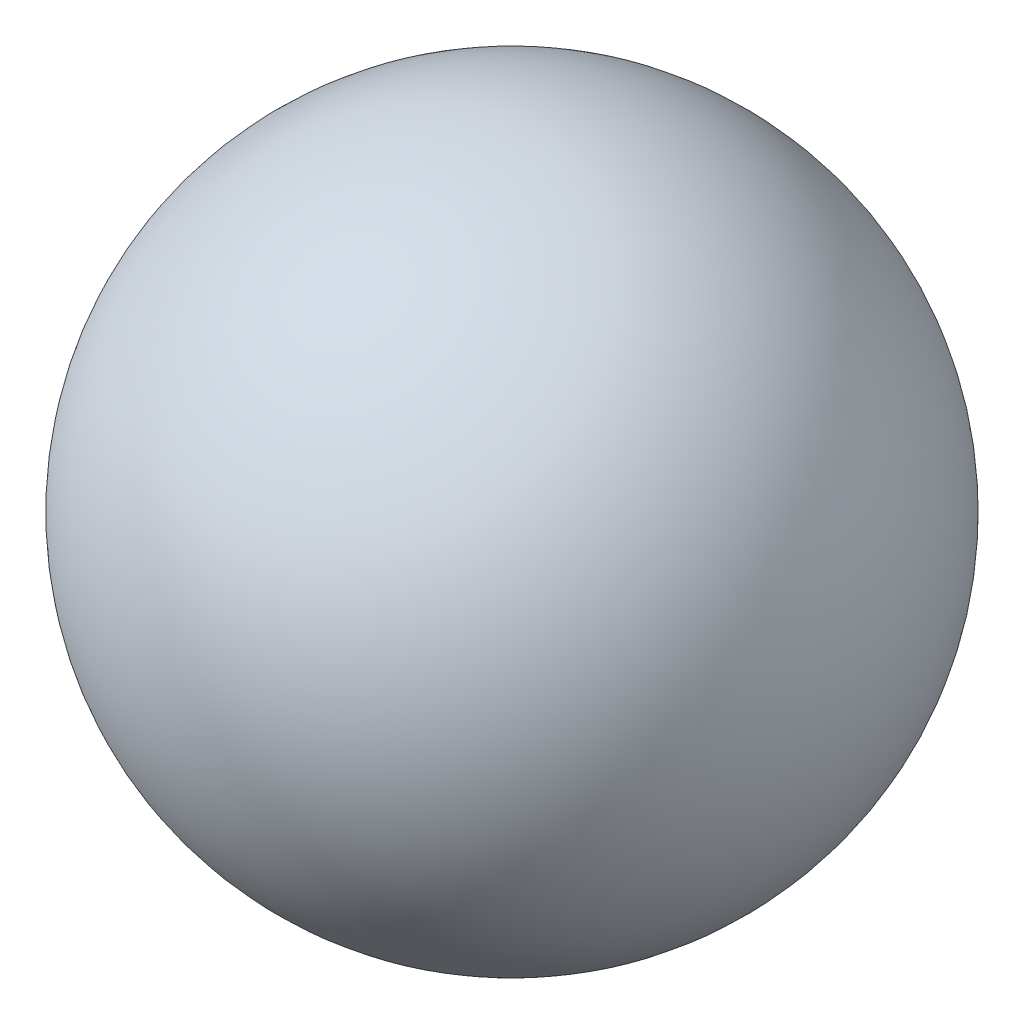
from build123d import *


with BuildPart() as part:
    # Sketch1 → Revolve1 (revolve)
    with BuildSketch(Plane.XY):
        with BuildLine():
            Line((0, 12.5), (0, -12.5))
            ThreePointArc((0, -12.5), (12.5, 0), (0, 12.5))
        make_face()
    revolve(axis=Axis((0, -12.5, 0), (0, 1, 0)))


solid = part.part
